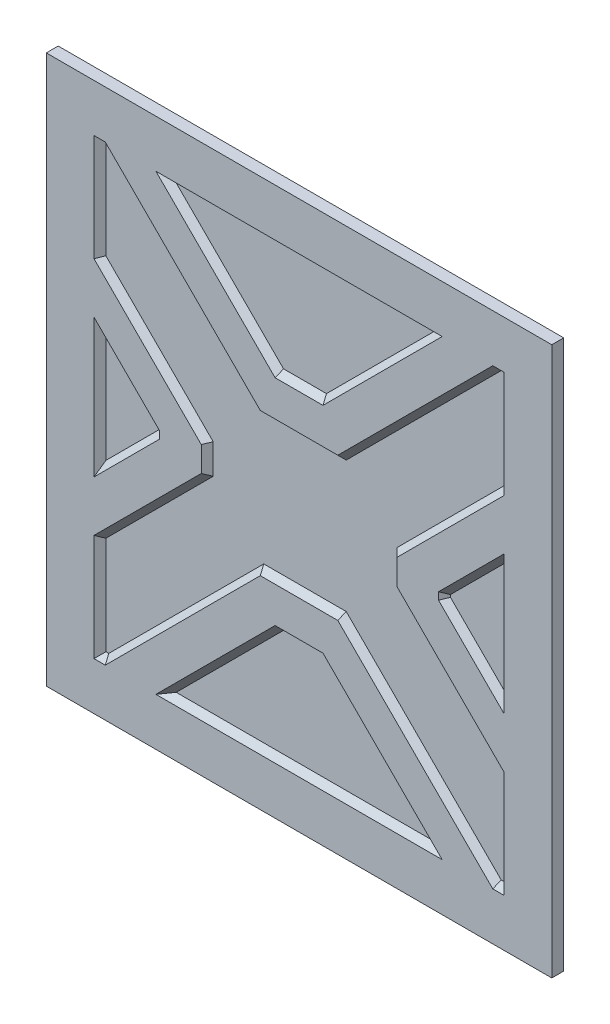
from build123d import *

# Parameters (mm, degrees)
ESQUISSE1_W             = 424
ESQUISSE1_H             = 460
BOSS_EXTRU_1_DEPTH      = 10
ENL_V_MAT_EXTRU_1_DEPTH = 5
CHANFREIN1_SIZE         = 5


with BuildPart() as part:
    # Esquisse1 → Boss.-Extru.1 (new body)
    with BuildSketch(Plane.XY):
        with Locations((212, 230)):
            Rectangle(ESQUISSE1_W, ESQUISSE1_H)
    extrude(amount=BOSS_EXTRU_1_DEPTH)

    # Esquisse2 → Enlèv. mat.-Extru.1 (cut)
    with BuildSketch(Plane.XY.offset(10)):
        Polygon((95, 226.923881554), (95, 233.076118446), (40, 288.076118446), (40, 171.923881554), align=None)
        Polygon((191.923881554, 320), (232.076118446, 320), (332.076118446, 420), (91.923881554, 420), align=None)
        Polygon((40, 420), (40, 330.502525317), (130, 240.502525317), (130, 219.497474683), (40, 129.497474683), (40, 40), (49.497474683, 40), (179.497474683, 170), (244.502525317, 170), (374.502525317, 40), (384, 40), (384, 129.497474683), (294, 219.497474683), (294, 240.502525317), (384, 330.502525317), (384, 420), (374.502525317, 420), (244.502525317, 290), (179.497474683, 290), (49.497474683, 420), align=None)
        Polygon((329, 226.923881554), (329, 233.076118446), (384, 288.076118446), (384, 171.923881554), align=None)
        Polygon((332.076118446, 40), (91.923881554, 40), (191.923881554, 140), (232.076118446, 140), align=None)
    extrude(amount=-ENL_V_MAT_EXTRU_1_DEPTH, mode=Mode.SUBTRACT)

    # Chanfrein1
    chanfrein1_edges = [part.edges().sort_by_distance(p)[0] for p in [
        (212, 40, 5),
        (141.923881554, 90, 5),
        (212, 140, 5),
        (282.076118446, 90, 5),
        (40, 230, 5),
        (67.5, 260.576118446, 5),
        (95, 230, 5),
        (67.5, 199.423881554, 5),
        (384, 230, 5),
        (356.5, 199.423881554, 5),
        (329, 230, 5),
        (356.5, 260.576118446, 5),
        (114.497474683, 355, 5),
        (212, 290, 5),
        (309.502525317, 355, 5),
        (379.251262658, 420, 5),
        (384, 375.251262658, 5),
        (339, 285.502525317, 5),
        (294, 230, 5),
        (339, 174.497474683, 5),
        (384, 84.748737342, 5),
        (379.251262658, 40, 5),
        (309.502525317, 105, 5),
        (212, 170, 5),
        (114.497474683, 105, 5),
        (44.748737342, 40, 5),
        (40, 84.748737342, 5),
        (85, 174.497474683, 5),
        (130, 230, 5),
        (85, 285.502525317, 5),
        (40, 375.251262658, 5),
        (44.748737342, 420, 5),
        (212, 420, 5),
        (282.076118446, 370, 5),
        (212, 320, 5),
        (141.923881554, 370, 5),
    ]]
    chamfer(chanfrein1_edges, length=CHANFREIN1_SIZE - 0.0001)  # a hair under: the kernel refuses the full size


solid = part.part
